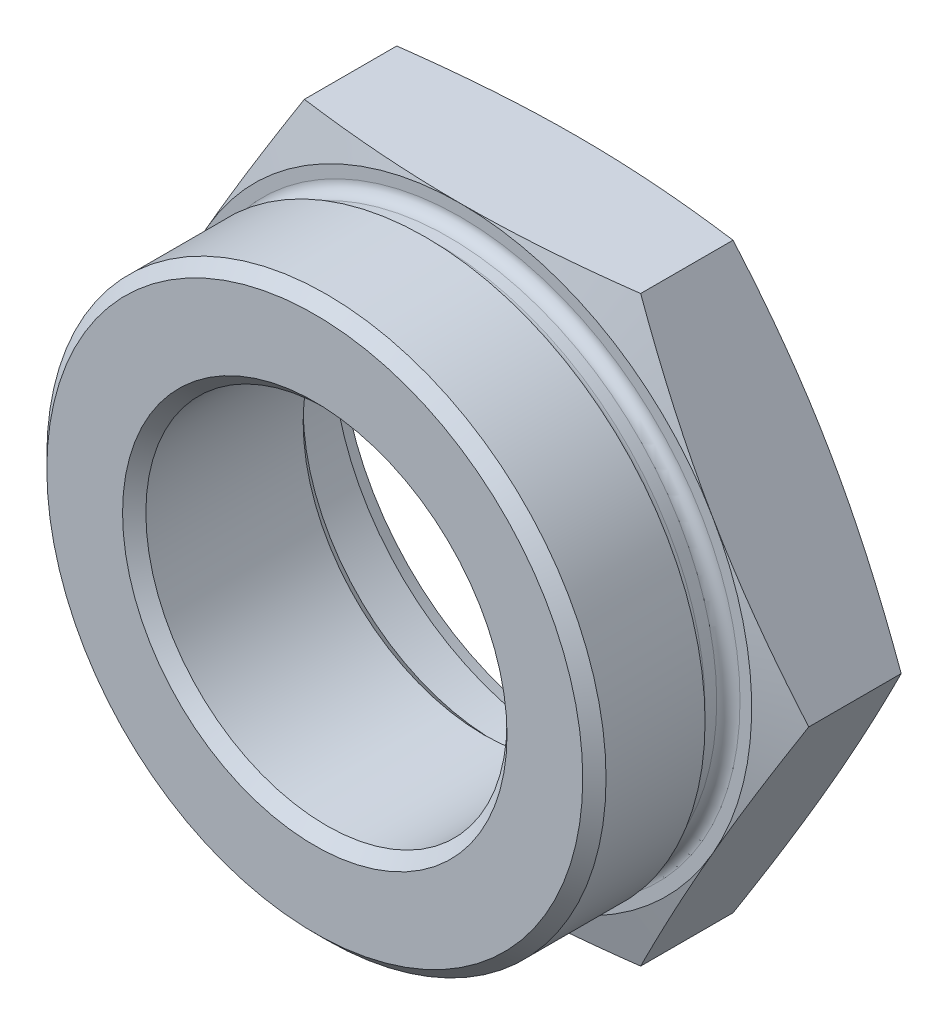
from build123d import *

# Parameters (mm, degrees)
BOSS_EXTRUDE1_DEPTH = 10
SKETCH2_R           = 24
BOSS_EXTRUDE2_DEPTH = 12.5
SKETCH3_R           = 20
CUT_EXTRUDE1_DEPTH  = 7
CUT_EXTRUDE2_REACH  = 43.214
SKETCH4_R           = 15.5
CHAMFER1_SIZE       = 1
CHAMFER2_SIZE       = 1
CHAMFER2_SIZE2      = 0.267949192
SKETCH5_W           = 1
SKETCH5_H           = 3
FILLET1_R           = 1


with BuildPart() as part:
    # Sketch1 → Boss-Extrude1 (new body)
    with BuildSketch(Plane.XY):
        Polygon((28.867513459, 0), (14.43375673, 25), (-14.43375673, 25), (-28.867513459, 0), (-14.43375673, -25), (14.43375673, -25), align=None)
    extrude(amount=BOSS_EXTRUDE1_DEPTH)

    # Sketch2 → Boss-Extrude2 (add)
    with BuildSketch(Plane.XY.offset(10)):
        Circle(SKETCH2_R)
    extrude(amount=BOSS_EXTRUDE2_DEPTH)

    # Sketch3 → Cut-Extrude1 (cut)
    with BuildSketch(Plane(origin=(0, 0, 0), x_dir=(-1, 0, 0), z_dir=(0, 0, -1))):
        Circle(SKETCH3_R)
    extrude(amount=-CUT_EXTRUDE1_DEPTH, mode=Mode.SUBTRACT)

    # Sketch4 → Cut-Extrude2 (cut, up to next)
    with BuildSketch(Plane(origin=(0, 0, 7), x_dir=(-1, 0, 0), z_dir=(0, 0, -1)), mode=Mode.PRIVATE) as cut_extrude2_sk1:
        Circle(SKETCH4_R)
    cut_extrude2_tool1 = extrude(cut_extrude2_sk1.sketch, amount=-CUT_EXTRUDE2_REACH, mode=Mode.PRIVATE) & part.part
    add(cut_extrude2_tool1.solids().sort_by_distance((0, 0, 7))[0], mode=Mode.SUBTRACT)

    # Chamfer1
    chamfer1_edges = [part.edges().sort_by_distance(p)[0] for p in [
        (-24, 0, 22.5),
        (15.5, 0, 22.5),
        (15.5, 0, 7),
    ]]
    chamfer(chamfer1_edges, length=CHAMFER1_SIZE)

    # Chamfer2
    chamfer2_edges = [part.edges().sort_by_distance(p)[0] for p in [
        (20, 0, 0),
    ]]
    chamfer2_side = [part.faces().sort_by_distance(p)[0] for p in [
        (20, 0, 3.5),
    ]]
    chamfer(chamfer2_edges, length=CHAMFER2_SIZE, length2=CHAMFER2_SIZE2, reference=chamfer2_side[0])

    # Sketch5 → Cut-Revolve1 (revolve, cut)
    with BuildSketch(Plane(origin=(0, 0, 0), x_dir=(1, 0, 0), z_dir=(0, 1, 0))):
        Polygon((25, -10), (28.867513459, -8.963702892), (28.867513459, -10), align=None)
        with Locations((23.5, -11.5)):
            Rectangle(SKETCH5_W, SKETCH5_H)
        Polygon((28.867513459, 0), (28.867513459, -1.036297108), (25, 0), align=None)
    revolve(axis=Axis((0, 0, -102.328960849), (0, 0, 1)), mode=Mode.SUBTRACT)

    # Fillet1
    fillet1_edges = [part.edges().sort_by_distance(p)[0] for p in [
        (-23, 0, 13),
        (-23, 0, 10),
    ]]
    fillet(fillet1_edges, radius=FILLET1_R - 0.0001)  # a hair under: the kernel refuses the full size


solid = part.part
